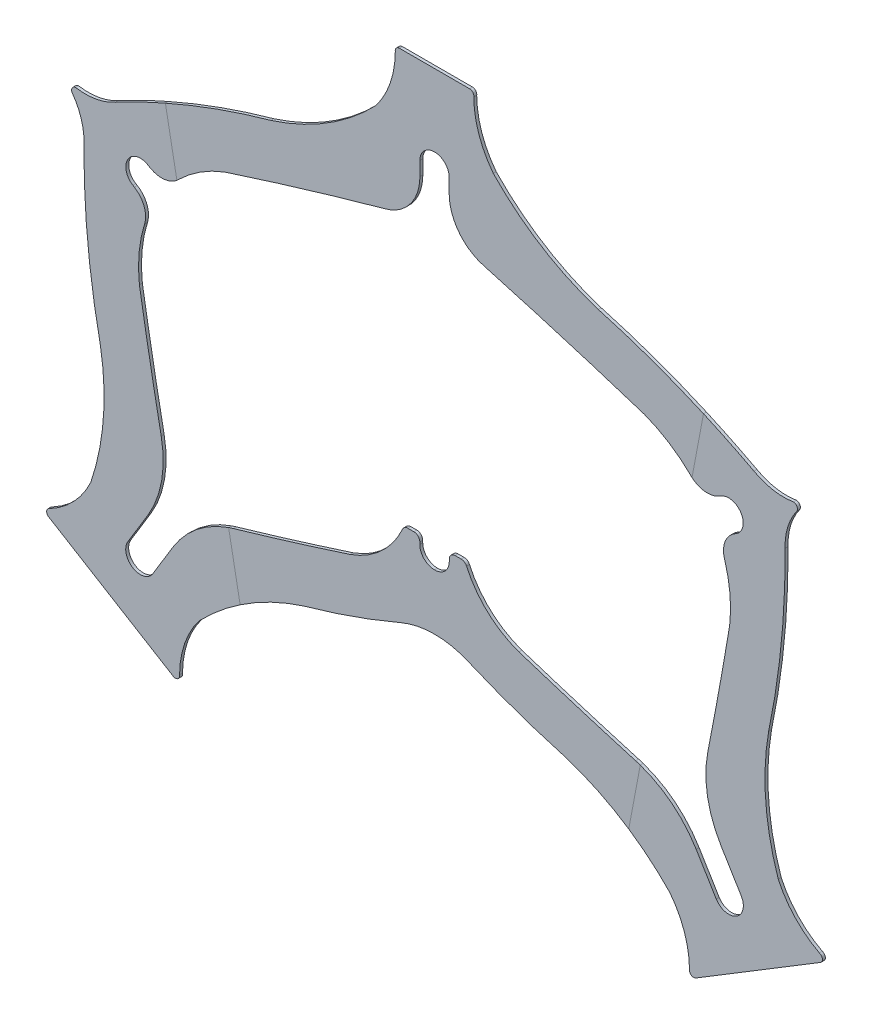
from build123d import *

# Parameters (mm, degrees)
BOSS_EXTRUDE1_DEPTH = 6.35
SPLIT1_DEPTH        = 6.35
SPLIT1_2_DEPTH      = 6.35
SPLIT1_3_DEPTH      = 6.35
SPLIT1_4_DEPTH      = 6.35


# Read off the part's stored shape, not the designer's step: Split1
with BuildPart() as part:
    # Model → Boss-Extrude1 (new body)
    with BuildSketch(Plane.XY):
        with BuildLine():
            Line((-701.97988244, -432.983670442), (-837.094869811, -350.834598439))
            ThreePointArc((-837.094869811, -350.834598439), (-841.449064657, -341.794482807), (-834.966129535, -334.135876171))
            ThreePointArc((-834.966129535, -334.135876171), (-782.541092233, -294.416954554), (-745.623103349, -239.983147345))
            ThreePointArc((-745.623103349, -239.983147345), (-718.445209635, -107.710940698), (-724.729968779, 27.178185478))
            ThreePointArc((-724.729968779, 27.178185478), (-752.345626075, 207.261932405), (-760.486593003, 389.268814397))
            ThreePointArc((-760.486593003, 389.268814397), (-766.490822748, 433.023385067), (-786.532760791, 472.378612786))
            ThreePointArc((-786.532760791, 472.378612786), (-787.330234843, 476.731956148), (-786.006303644, 480.955079337))
            ThreePointArc((-786.006303644, 480.955079337), (-782.866294484, 484.07403842), (-778.634361676, 485.36953369))
            ThreePointArc((-778.634361676, 485.36953369), (-734.470896765, 485.688275725), (-692.862111012, 500.494429092))
            ThreePointArc((-692.862111012, 500.494429092), (-527.52888984, 577.030083604), (-354.940391274, 635.390948892))
            ThreePointArc((-354.940391274, 635.390948892), (-253.509234761, 679.355930363), (-163.078201869, 742.94388046))
            ThreePointArc((-163.078201869, 742.94388046), (-144.838382232, 759.513402684), (-127.368719852, 776.893016703))
            ThreePointArc((-127.368719852, 776.893016703), (-96.032528762, 834.720522257), (-84.896940711, 899.543172228))
            ThreePointArc((-84.896940711, 899.543172228), (-82.931569185, 907.128356023), (-75.83919572, 910.459412475))
            Line((-75.83919572, 910.459412475), (0.226609322, 910.459412475))
            Line((0.226609322, 910.459412475), (76.292414364, 910.459412475))
            ThreePointArc((76.292414364, 910.459412475), (83.384787829, 907.128356023), (85.350159356, 899.543172228))
            ThreePointArc((85.350159356, 899.543172228), (96.485747406, 834.720522257), (127.821938496, 776.893016703))
            ThreePointArc((127.821938496, 776.893016703), (145.291600877, 759.513402684), (163.531420514, 742.94388046))
            ThreePointArc((163.531420514, 742.94388046), (253.962453405, 679.355930363), (355.393609919, 635.390948892))
            ThreePointArc((355.393609919, 635.390948892), (527.982108486, 577.030083603), (693.315329659, 500.49442909))
            ThreePointArc((693.315329659, 500.49442909), (734.924115411, 485.688275725), (779.087580321, 485.36953369))
            ThreePointArc((779.087580321, 485.36953369), (783.319513129, 484.07403842), (786.459522289, 480.955079337))
            ThreePointArc((786.459522289, 480.955079337), (787.783453488, 476.731956148), (786.985979436, 472.378612786))
            ThreePointArc((786.985979436, 472.378612786), (766.944041392, 433.023385067), (760.939811647, 389.268814397))
            ThreePointArc((760.939811647, 389.268814397), (752.798844719, 207.261932405), (725.183187424, 27.178185478))
            ThreePointArc((725.183187424, 27.178185478), (718.898428279, -107.710940698), (746.076321994, -239.983147345))
            ThreePointArc((746.076321994, -239.983147345), (782.994310878, -294.416954554), (835.41934818, -334.135876171))
            ThreePointArc((835.41934818, -334.135876171), (841.902283302, -341.794482807), (837.548088456, -350.834598439))
            Line((837.548088456, -350.834598439), (702.433101084, -432.983670442))
            Line((702.433101084, -432.983670442), (567.318113713, -515.132742445))
            ThreePointArc((567.318113713, -515.132742445), (557.288367217, -514.837973691), (553.472597186, -505.557747268))
            ThreePointArc((553.472597186, -505.557747268), (542.337009136, -440.735097297), (511.000818046, -382.907591743))
            ThreePointArc((511.000818046, -382.907591743), (493.531155665, -365.527977724), (475.291336028, -348.9584555))
            ThreePointArc((475.291336028, -348.9584555), (384.86030314, -285.370505404), (283.429146629, -241.405523934))
            ThreePointArc((283.429146629, -241.405523934), (176.999835103, -207.870139734), (73.005896052, -167.409282279))
            ThreePointArc((73.005896052, -167.409282279), (37.371227738, -156.288092418), (0.226609322, -152.574903425))
            ThreePointArc((0.226609322, -152.574903425), (-36.918009094, -156.288092418), (-72.552677408, -167.409282279))
            ThreePointArc((-72.552677408, -167.409282279), (-176.546616457, -207.870139733), (-282.975927981, -241.405523933))
            ThreePointArc((-282.975927981, -241.405523933), (-384.407084494, -285.370505403), (-474.838117383, -348.958455501))
            ThreePointArc((-474.838117383, -348.958455501), (-493.077937021, -365.527977724), (-510.547599401, -382.907591743))
            ThreePointArc((-510.547599401, -382.907591743), (-541.883790491, -440.735097297), (-553.019378541, -505.557747268))
            ThreePointArc((-553.019378541, -505.557747268), (-556.835148572, -514.837973691), (-566.864895068, -515.132742445))
            Line((-566.864895068, -515.132742445), (-701.97988244, -432.983670442))
        make_face()
        with BuildLine():
            Line((-665.272186162, -311.493186772), (-621.78259659, -239.963524872))
            ThreePointArc((-621.78259659, -239.963524872), (-592.030513461, -161.150183252), (-592.84508945, -76.912034331))
            ThreePointArc((-592.84508945, -76.912034331), (-617.522255103, 53.287130202), (-640.198587445, 183.849639757))
            ThreePointArc((-640.198587445, 183.849639757), (-640.904393221, 244.166049047), (-629.07550509, 303.315392212))
            ThreePointArc((-629.07550509, 303.315392212), (-630.057428507, 336.378288345), (-651.186613315, 361.827783893))
            Line((-651.186613315, 361.827783893), (-654.429109389, 363.79920134))
            ThreePointArc((-654.429109389, 363.79920134), (-665.063947063, 407.422878715), (-621.440269689, 418.057716389))
            Line((-621.440269689, 418.057716389), (-618.197773616, 416.086298942))
            ThreePointArc((-618.197773616, 416.086298942), (-585.879511568, 409.040079206), (-556.074212638, 423.384535628))
            ThreePointArc((-556.074212638, 423.384535628), (-509.005035062, 461.10800198), (-455.131011212, 488.240214305))
            ThreePointArc((-455.131011212, 488.240214305), (-281.050058852, 542.736629981), (-105.856855128, 593.543899788))
            ThreePointArc((-105.856855128, 593.543899788), (-52.213440689, 629.966451207), (-31.523390666, 691.416756289))
            Line((-31.523390666, 691.416756289), (-31.523390666, 721.973032069))
            ThreePointArc((-31.523390666, 721.973032069), (-22.224030969, 744.423672372), (0.226609334, 753.723032069))
            ThreePointArc((0.226609334, 753.723032069), (22.677249637, 744.423672372), (31.976609334, 721.973032069))
            Line((31.976609334, 721.973032069), (31.976609334, 691.416756289))
            ThreePointArc((31.976609334, 691.416756289), (52.666659357, 629.966451207), (106.310073796, 593.543899788))
            ThreePointArc((106.310073796, 593.543899788), (281.50327752, 542.736629981), (455.58422988, 488.240214305))
            ThreePointArc((455.58422988, 488.240214305), (509.45825373, 461.10800198), (556.527431306, 423.384535628))
            ThreePointArc((556.527431306, 423.384535628), (586.332730236, 409.040079206), (618.650992284, 416.086298942))
            Line((618.650992284, 416.086298942), (621.893488357, 418.057716389))
            ThreePointArc((621.893488357, 418.057716389), (665.517165732, 407.422878715), (654.882328058, 363.79920134))
            Line((654.882328058, 363.79920134), (651.639831983, 361.827783893))
            ThreePointArc((651.639831983, 361.827783893), (630.510647175, 336.378288345), (629.528723759, 303.315392212))
            ThreePointArc((629.528723759, 303.315392212), (641.357611889, 244.166049047), (640.651806113, 183.849639757))
            ThreePointArc((640.651806113, 183.849639757), (617.975473762, 53.287130202), (593.2983081, -76.912034331))
            ThreePointArc((593.2983081, -76.912034331), (592.483732112, -161.150183252), (622.235815241, -239.963524872))
            Line((622.235815241, -239.963524872), (665.725404813, -311.493186772))
            ThreePointArc((665.725404813, -311.493186772), (655.090567139, -355.116864146), (611.466889764, -344.482026472))
            Line((611.466889764, -344.482026472), (567.977300192, -272.952364572))
            ThreePointArc((567.977300192, -272.952364572), (511.698946797, -210.266830296), (436.537029391, -172.221916837))
            ThreePointArc((436.537029391, -172.221916837), (309.588655808, -134.210137165), (183.23852668, -94.254789354))
            ThreePointArc((183.23852668, -94.254789354), (115.74266918, -53.763259161), (69.669204583, 10.052809797))
            ThreePointArc((69.669204583, 10.052809797), (64.983546289, 15.50677954), (58.087315234, 17.542259052))
            Line((58.087315234, 17.542259052), (44.903218651, 17.542259052))
            ThreePointArc((44.903218651, 17.542259052), (35.92296253, 13.822515173), (32.203218651, 4.842259052))
            Line((32.203218651, 4.842259052), (32.203218651, 0))
            ThreePointArc((32.203218651, 0), (22.823596989, -22.530616349), (0.226609326, -31.7491913))
            ThreePointArc((0.226609326, -31.7491913), (-22.370378338, -22.530616349), (-31.75, 0))
            Line((-31.75, 0), (-31.75, 4.842259052))
            ThreePointArc((-31.75, 4.842259052), (-35.469743879, 13.822515173), (-44.45, 17.542259052))
            Line((-44.45, 17.542259052), (-57.634096583, 17.542259052))
            ThreePointArc((-57.634096583, 17.542259052), (-64.530327638, 15.50677954), (-69.215985932, 10.052809797))
            ThreePointArc((-69.215985932, 10.052809797), (-115.289450529, -53.763259161), (-182.785308029, -94.254789354))
            ThreePointArc((-182.785308029, -94.254789354), (-309.135437158, -134.210137166), (-436.083810742, -172.221916838))
            ThreePointArc((-436.083810742, -172.221916838), (-511.245728147, -210.266830297), (-567.524081541, -272.952364572))
            Line((-567.524081541, -272.952364572), (-611.013671113, -344.482026472))
            ThreePointArc((-611.013671113, -344.482026472), (-654.637348488, -355.116864146), (-665.272186162, -311.493186772))
        make_face(mode=Mode.SUBTRACT)
    extrude(amount=BOSS_EXTRUDE1_DEPTH)

    # Split1 2 outline → Split1 2 (cut)
    with BuildSketch(Plane.XY):
        with BuildLine():
            Line((-421.626142063, -308.248372549), (-446.607072835, -175.56277304))
            ThreePointArc((-446.607072835, -175.56277304), (-515.586871889, -213.677696261), (-567.524081541, -272.952364572))
            Line((-567.524081541, -272.952364572), (-611.013671113, -344.482026472))
            ThreePointArc((-611.013671113, -344.482026472), (-654.637348487, -355.116864146), (-665.272186162, -311.493186772))
            Line((-665.272186162, -311.493186772), (-621.78259659, -239.963524872))
            ThreePointArc((-621.78259659, -239.963524872), (-592.030513461, -161.150183252), (-592.84508945, -76.91203433))
            ThreePointArc((-592.84508945, -76.91203433), (-617.522255103, 53.287130202), (-640.198587445, 183.849639757))
            ThreePointArc((-640.198587445, 183.849639757), (-640.904393221, 244.166049046), (-629.07550509, 303.315392212))
            ThreePointArc((-629.07550509, 303.315392212), (-630.057428507, 336.378288345), (-651.186613315, 361.827783893))
            Line((-651.186613315, 361.827783893), (-654.429109389, 363.79920134))
            ThreePointArc((-654.429109389, 363.79920134), (-665.063947063, 407.422878714), (-621.440269689, 418.057716389))
            Line((-621.440269689, 418.057716389), (-618.197773616, 416.086298942))
            ThreePointArc((-618.197773616, 416.086298942), (-585.879511568, 409.040079206), (-556.074212638, 423.384535628))
            ThreePointArc((-556.074212638, 423.384535628), (-509.005035061, 461.10800198), (-455.131011212, 488.240214305))
            ThreePointArc((-455.131011212, 488.240214305), (-281.050058852, 542.736629981), (-105.856855128, 593.543899788))
            ThreePointArc((-105.856855128, 593.543899788), (-52.213440689, 629.966451207), (-31.523390666, 691.416756289))
            Line((-31.523390666, 691.416756289), (-31.523390666, 721.973032069))
            ThreePointArc((-31.523390666, 721.973032069), (0.226609334, 753.723032069), (31.976609334, 721.973032069))
            Line((31.976609334, 721.973032069), (31.976609334, 691.416756289))
            ThreePointArc((31.976609334, 691.416756289), (52.666659357, 629.966451207), (106.310073796, 593.543899788))
            ThreePointArc((106.310073796, 593.543899788), (281.50327752, 542.736629981), (455.58422988, 488.240214305))
            ThreePointArc((455.58422988, 488.240214305), (509.458253729, 461.10800198), (556.527431306, 423.384535628))
            ThreePointArc((556.527431306, 423.384535628), (586.332730236, 409.040079206), (618.650992284, 416.086298942))
            Line((618.650992284, 416.086298942), (621.893488357, 418.057716389))
            ThreePointArc((621.893488357, 418.057716389), (665.517165732, 407.422878715), (654.882328058, 363.79920134))
            Line((654.882328058, 363.79920134), (651.639831983, 361.827783893))
            ThreePointArc((651.639831983, 361.827783893), (630.510647175, 336.378288345), (629.528723759, 303.315392212))
            ThreePointArc((629.528723759, 303.315392212), (641.357611889, 244.166049046), (640.651806113, 183.849639757))
            ThreePointArc((640.651806113, 183.849639757), (617.975473762, 53.287130202), (593.2983081, -76.912034331))
            ThreePointArc((593.2983081, -76.912034331), (592.483732112, -161.150183252), (622.235815241, -239.963524872))
            Line((622.235815241, -239.963524872), (665.725404813, -311.493186772))
            ThreePointArc((665.725404813, -311.493186772), (655.090567138, -355.116864146), (611.466889764, -344.482026472))
            Line((611.466889764, -344.482026472), (567.977300192, -272.952364572))
            ThreePointArc((567.977300192, -272.952364572), (515.86475783, -213.536621129), (446.634577744, -175.416681393))
            Line((446.634577744, -175.416681393), (421.676967884, -307.978412452))
            ThreePointArc((421.676967884, -307.978412452), (468.354774823, -343.03984847), (511.000818046, -382.907591743))
            ThreePointArc((511.000818046, -382.907591743), (542.337009136, -440.735097296), (553.472597186, -505.557747268))
            ThreePointArc((553.472597186, -505.557747268), (557.288367217, -514.837973691), (567.318113713, -515.132742445))
            Line((567.318113713, -515.132742445), (837.548088456, -350.834598439))
            ThreePointArc((837.548088456, -350.834598439), (841.902283302, -341.794482807), (835.41934818, -334.135876171))
            ThreePointArc((835.41934818, -334.135876171), (782.994310878, -294.416954554), (746.076321994, -239.983147345))
            ThreePointArc((746.076321994, -239.983147345), (718.898428279, -107.710940698), (725.183187424, 27.178185478))
            ThreePointArc((725.183187424, 27.178185478), (752.798844719, 207.261932405), (760.939811647, 389.268814397))
            ThreePointArc((760.939811647, 389.268814397), (766.944041392, 433.023385067), (786.985979436, 472.378612786))
            ThreePointArc((786.985979436, 472.378612786), (786.459522289, 480.955079337), (779.087580321, 485.36953369))
            ThreePointArc((779.087580321, 485.36953369), (734.924115412, 485.688275725), (693.315329659, 500.49442909))
            ThreePointArc((693.315329659, 500.49442909), (527.982108486, 577.030083603), (355.393609919, 635.390948892))
            ThreePointArc((355.393609919, 635.390948892), (232.746022913, 691.890010476), (127.821938496, 776.893016703))
            ThreePointArc((127.821938496, 776.893016703), (96.485747406, 834.720522256), (85.350159356, 899.543172228))
            ThreePointArc((85.350159356, 899.543172228), (83.384787829, 907.128356023), (76.292414364, 910.459412475))
            Line((76.292414364, 910.459412475), (-75.83919572, 910.459412475))
            ThreePointArc((-75.83919572, 910.459412475), (-82.931569185, 907.128356023), (-84.896940711, 899.543172228))
            ThreePointArc((-84.896940711, 899.543172228), (-96.032528762, 834.720522257), (-127.368719852, 776.893016703))
            ThreePointArc((-127.368719852, 776.893016703), (-232.292804268, 691.890010476), (-354.940391274, 635.390948892))
            ThreePointArc((-354.940391274, 635.390948892), (-527.52888984, 577.030083604), (-692.862111012, 500.494429092))
            ThreePointArc((-692.862111012, 500.494429092), (-734.470896765, 485.688275725), (-778.634361676, 485.36953369))
            ThreePointArc((-778.634361676, 485.36953369), (-786.006303644, 480.955079337), (-786.532760791, 472.378612786))
            ThreePointArc((-786.532760791, 472.378612786), (-766.490822748, 433.023385067), (-760.486593003, 389.268814397))
            ThreePointArc((-760.486593003, 389.268814397), (-752.345626075, 207.261932405), (-724.729968779, 27.178185478))
            ThreePointArc((-724.729968779, 27.178185478), (-718.445209635, -107.710940698), (-745.623103349, -239.983147345))
            ThreePointArc((-745.623103349, -239.983147345), (-782.541092233, -294.416954554), (-834.966129535, -334.135876171))
            ThreePointArc((-834.966129535, -334.135876171), (-841.449064657, -341.794482807), (-837.094869811, -350.834598439))
            Line((-837.094869811, -350.834598439), (-566.864895068, -515.132742445))
            ThreePointArc((-566.864895068, -515.132742445), (-556.835148572, -514.837973691), (-553.019378541, -505.557747268))
            ThreePointArc((-553.019378541, -505.557747268), (-541.883790491, -440.735097296), (-510.547599401, -382.907591743))
            ThreePointArc((-510.547599401, -382.907591743), (-468.087141673, -343.195597103), (-421.626142063, -308.248372549))
        make_face()
    extrude(amount=SPLIT1_2_DEPTH, mode=Mode.SUBTRACT)


with BuildPart() as body_2:
    # Split1 outline → Split1 (new body)
    with BuildSketch(Plane.XY):
        with BuildLine():
            Line((446.634577744, -175.416681392), (421.676967884, -307.978412452))
            ThreePointArc((421.676967884, -307.978412452), (468.354774823, -343.03984847), (511.000818046, -382.907591743))
            ThreePointArc((511.000818046, -382.907591743), (542.337009136, -440.735097296), (553.472597186, -505.557747268))
            ThreePointArc((553.472597186, -505.557747268), (557.288367217, -514.837973691), (567.318113713, -515.132742445))
            Line((567.318113713, -515.132742445), (837.548088456, -350.834598439))
            ThreePointArc((837.548088456, -350.834598439), (841.902283302, -341.794482807), (835.41934818, -334.135876171))
            ThreePointArc((835.41934818, -334.135876171), (782.994310878, -294.416954554), (746.076321994, -239.983147345))
            ThreePointArc((746.076321994, -239.983147345), (718.898428279, -107.710940698), (725.183187424, 27.178185478))
            ThreePointArc((725.183187424, 27.178185478), (752.798844719, 207.261932405), (760.939811647, 389.268814397))
            ThreePointArc((760.939811647, 389.268814397), (766.944041392, 433.023385067), (786.985979436, 472.378612786))
            ThreePointArc((786.985979436, 472.378612786), (786.459522289, 480.955079337), (779.087580321, 485.36953369))
            ThreePointArc((779.087580321, 485.36953369), (734.924115412, 485.688275725), (693.315329659, 500.49442909))
            ThreePointArc((693.315329659, 500.49442909), (639.072495934, 528.003375328), (583.878294647, 553.549946093))
            Line((583.878294647, 553.549946093), (558.949095192, 421.139116203))
            ThreePointArc((558.949095192, 421.139116203), (587.975823427, 408.874077881), (618.650992284, 416.086298942))
            Line((618.650992284, 416.086298942), (621.893488357, 418.057716389))
            ThreePointArc((621.893488357, 418.057716389), (665.517165732, 407.422878715), (654.882328058, 363.79920134))
            Line((654.882328058, 363.79920134), (651.639831983, 361.827783893))
            ThreePointArc((651.639831983, 361.827783893), (630.510647175, 336.378288345), (629.528723759, 303.315392212))
            ThreePointArc((629.528723759, 303.315392212), (641.357611889, 244.166049046), (640.651806113, 183.849639757))
            ThreePointArc((640.651806113, 183.849639757), (617.975473762, 53.287130202), (593.2983081, -76.912034331))
            ThreePointArc((593.2983081, -76.912034331), (592.483732112, -161.150183252), (622.235815241, -239.963524872))
            Line((622.235815241, -239.963524872), (665.725404813, -311.493186772))
            ThreePointArc((665.725404813, -311.493186772), (655.090567138, -355.116864146), (611.466889764, -344.482026472))
            Line((611.466889764, -344.482026472), (567.977300192, -272.952364572))
            ThreePointArc((567.977300192, -272.952364572), (515.86475783, -213.536621129), (446.634577744, -175.416681392))
        make_face()
    extrude(amount=SPLIT1_DEPTH)


with BuildPart() as body_3:
    # Split1 3 outline → Split1 3 (new body)
    with BuildSketch(Plane.XY):
        with BuildLine():
            Line((-558.885959893, 420.803774616), (-583.843519436, 553.365238414))
            ThreePointArc((-583.843519436, 553.365238414), (-638.8250602, 527.903593807), (-692.862111012, 500.494429092))
            ThreePointArc((-692.862111012, 500.494429092), (-734.470896765, 485.688275725), (-778.634361676, 485.36953369))
            ThreePointArc((-778.634361676, 485.36953369), (-786.006303644, 480.955079337), (-786.532760791, 472.378612786))
            ThreePointArc((-786.532760791, 472.378612786), (-766.490822748, 433.023385067), (-760.486593003, 389.268814397))
            ThreePointArc((-760.486593003, 389.268814397), (-752.345626075, 207.261932405), (-724.729968779, 27.178185478))
            ThreePointArc((-724.729968779, 27.178185478), (-718.445209635, -107.710940698), (-745.623103349, -239.983147345))
            ThreePointArc((-745.623103349, -239.983147345), (-782.541092233, -294.416954554), (-834.966129535, -334.135876171))
            ThreePointArc((-834.966129535, -334.135876171), (-841.449064657, -341.794482807), (-837.094869811, -350.834598439))
            Line((-837.094869811, -350.834598439), (-566.864895068, -515.132742445))
            ThreePointArc((-566.864895068, -515.132742445), (-556.835148572, -514.837973691), (-553.019378541, -505.557747268))
            ThreePointArc((-553.019378541, -505.557747268), (-541.883790491, -440.735097296), (-510.547599401, -382.907591743))
            ThreePointArc((-510.547599401, -382.907591743), (-468.087141673, -343.195597103), (-421.626142063, -308.248372549))
            Line((-421.626142063, -308.248372549), (-446.607072835, -175.56277304))
            ThreePointArc((-446.607072835, -175.56277304), (-515.586871889, -213.677696261), (-567.524081541, -272.952364572))
            Line((-567.524081541, -272.952364572), (-611.013671113, -344.482026472))
            ThreePointArc((-611.013671113, -344.482026472), (-654.637348487, -355.116864146), (-665.272186162, -311.493186772))
            Line((-665.272186162, -311.493186772), (-621.78259659, -239.963524872))
            ThreePointArc((-621.78259659, -239.963524872), (-592.030513461, -161.150183252), (-592.84508945, -76.91203433))
            ThreePointArc((-592.84508945, -76.91203433), (-617.522255103, 53.287130202), (-640.198587445, 183.849639757))
            ThreePointArc((-640.198587445, 183.849639757), (-640.904393221, 244.166049046), (-629.07550509, 303.315392212))
            ThreePointArc((-629.07550509, 303.315392212), (-630.057428507, 336.378288345), (-651.186613315, 361.827783893))
            Line((-651.186613315, 361.827783893), (-654.429109389, 363.79920134))
            ThreePointArc((-654.429109389, 363.79920134), (-665.063947063, 407.422878714), (-621.440269689, 418.057716389))
            Line((-621.440269689, 418.057716389), (-618.197773616, 416.086298942))
            ThreePointArc((-618.197773616, 416.086298942), (-587.77894908, 408.853035867), (-558.885959893, 420.803774616))
        make_face()
    extrude(amount=SPLIT1_3_DEPTH)


with BuildPart() as body_4:
    # Split1 4 outline → Split1 4 (new body)
    with BuildSketch(Plane.XY):
        with BuildLine():
            ThreePointArc((-354.940391274, 635.390948892), (-470.863719433, 598.485237613), (-583.843519436, 553.365238414))
            Line((-583.843519436, 553.365238414), (-558.885959893, 420.803774616))
            ThreePointArc((-558.885959893, 420.803774616), (-557.455841317, 422.067740175), (-556.074212638, 423.384535628))
            ThreePointArc((-556.074212638, 423.384535628), (-509.005035061, 461.10800198), (-455.131011212, 488.240214305))
            ThreePointArc((-455.131011212, 488.240214305), (-281.050058852, 542.736629981), (-105.856855128, 593.543899788))
            ThreePointArc((-105.856855128, 593.543899788), (-52.213440689, 629.966451207), (-31.523390666, 691.416756289))
            Line((-31.523390666, 691.416756289), (-31.523390666, 721.973032069))
            ThreePointArc((-31.523390666, 721.973032069), (0.226609334, 753.723032069), (31.976609334, 721.973032069))
            Line((31.976609334, 721.973032069), (31.976609334, 691.416756289))
            ThreePointArc((31.976609334, 691.416756289), (52.666659357, 629.966451207), (106.310073796, 593.543899788))
            ThreePointArc((106.310073796, 593.543899788), (281.50327752, 542.736629981), (455.58422988, 488.240214305))
            ThreePointArc((455.58422988, 488.240214305), (509.458253729, 461.10800198), (556.527431306, 423.384535628))
            ThreePointArc((556.527431306, 423.384535628), (557.72001175, 422.242141844), (558.949095192, 421.139116203))
            Line((558.949095192, 421.139116203), (583.878294647, 553.549946093))
            ThreePointArc((583.878294647, 553.549946093), (471.101639933, 598.562371702), (355.393609919, 635.390948892))
            ThreePointArc((355.393609919, 635.390948892), (232.746022913, 691.890010476), (127.821938496, 776.893016703))
            ThreePointArc((127.821938496, 776.893016703), (96.485747406, 834.720522256), (85.350159356, 899.543172228))
            ThreePointArc((85.350159356, 899.543172228), (83.384787829, 907.128356023), (76.292414364, 910.459412475))
            Line((76.292414364, 910.459412475), (-75.83919572, 910.459412475))
            ThreePointArc((-75.83919572, 910.459412475), (-82.931569185, 907.128356023), (-84.896940711, 899.543172228))
            ThreePointArc((-84.896940711, 899.543172228), (-96.032528762, 834.720522257), (-127.368719852, 776.893016703))
            ThreePointArc((-127.368719852, 776.893016703), (-232.292804268, 691.890010476), (-354.940391274, 635.390948892))
        make_face()
    extrude(amount=SPLIT1_4_DEPTH)


solid = Compound([part.part, body_2.part, body_3.part, body_4.part])
